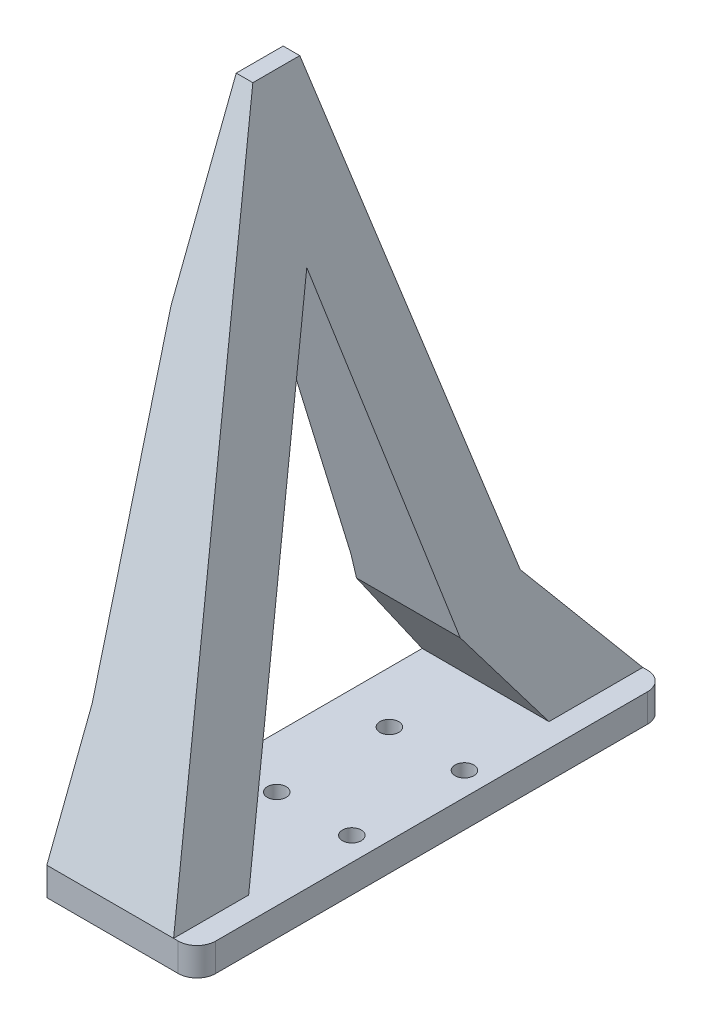
from build123d import *

# Parameters (mm, degrees)
SKETCH_1_R          = 1
EXTRUDE_1_DEPTH     = 3
SKETCH_2_W          = 16.007753667
SKETCH_2_H          = 50
EXTRUDE_2_DEPTH     = 80
CUT_EXTRUDE_1_DEPTH = 89.149011211
CUT_EXTRUDE_2_DEPTH = 81.960252593
EXTRUDE_3_DEPTH     = 3
CUT_EXTRUDE_3_DEPTH = 82.357621032


with BuildPart() as part:
    # 草图1 → 凸台-拉伸1 (new body)
    with BuildSketch(Plane(origin=(0, 0, 0), x_dir=(1, 0, 0), z_dir=(0, 1, 0))):
        with BuildLine():
            Line((-9.25, 25), (7.25, 25))
            ThreePointArc((7.25, 25), (8.664213562, 24.414213562), (9.25, 23))
            Line((9.25, 23), (9.25, -23))
            ThreePointArc((9.25, -23), (8.664213562, -24.414213562), (7.25, -25))
            Line((7.25, -25), (-9.25, -25))
            Line((-9.25, -25), (-9.25, 25))
        make_face()
        with Locations((-1.25, 6)):
            Circle(SKETCH_1_R, mode=Mode.SUBTRACT)
        with Locations((-1.25, -6)):
            Circle(SKETCH_1_R, mode=Mode.SUBTRACT)
        with Locations((6.75, -6)):
            Circle(SKETCH_1_R, mode=Mode.SUBTRACT)
        with Locations((6.75, 6)):
            Circle(SKETCH_1_R, mode=Mode.SUBTRACT)
    extrude(amount=EXTRUDE_1_DEPTH)

    # 草图2 → 凸台-拉伸2 (add)
    with BuildSketch(Plane(origin=(0, 3, 0), x_dir=(1, 0, 0), z_dir=(0, 1, 0))):
        with Locations((-1.246123166, 0)):
            Rectangle(SKETCH_2_W, SKETCH_2_H)
    extrude(amount=EXTRUDE_2_DEPTH)

    # 草图3 → 切除-拉伸1 (cut, through all)
    with BuildSketch(Plane(origin=(6.757753667, 0, 0), x_dir=(0, 0, -1), z_dir=(1, 0, 0))):
        Polygon((0, 47), (-17, 3), (15, 3), (8, 13), align=None)
        Polygon((25, 3), (15, 15.5), (3.181818182, 63), (-1.818181818, 63), (-25, 3), (-37.679958822, 3), (-37.679958822, 88.436899398), (63.328418147, 88.436899398), (63.328418147, 3), align=None)
    extrude(amount=-CUT_EXTRUDE_1_DEPTH, mode=Mode.SUBTRACT)

    # 草图4 → 切除-拉伸2 (cut, through all)
    with BuildSketch(Plane(origin=(0, 0, -25), x_dir=(-1, 0, 0), z_dir=(0, 0, -1))):
        Polygon((-6.757753667, 3), (8.40756476, 64.742116762), (-6.757753667, 64.742116762), align=None)
    extrude(amount=-CUT_EXTRUDE_2_DEPTH, mode=Mode.SUBTRACT)

    # 草图5 → 凸台-拉伸3 (add)
    with BuildSketch(Plane.ZY.offset(9.25)):
        Polygon((-3.181818182, 63), (-15, 15.5), (-25, 3), (-25, 0), (25, 0), (25, 3), (1.818181818, 63), align=None)
        Polygon((0, 47), (-8, 13), (-15, 3), (17, 3), align=None, mode=Mode.SUBTRACT)
    extrude(amount=EXTRUDE_3_DEPTH)

    # 草图6 → 切除-拉伸3 (cut, through all)
    with BuildSketch(Plane(origin=(0, 0, -25), x_dir=(-1, 0, 0), z_dir=(0, 0, -1))):
        Polygon((9.75, 65), (9.75, 45), (6.75, 15.5), (6.75, 0), (15.065136108, 0), (15.065136108, 65), align=None)
    extrude(amount=-CUT_EXTRUDE_3_DEPTH, mode=Mode.SUBTRACT)


solid = part.part
